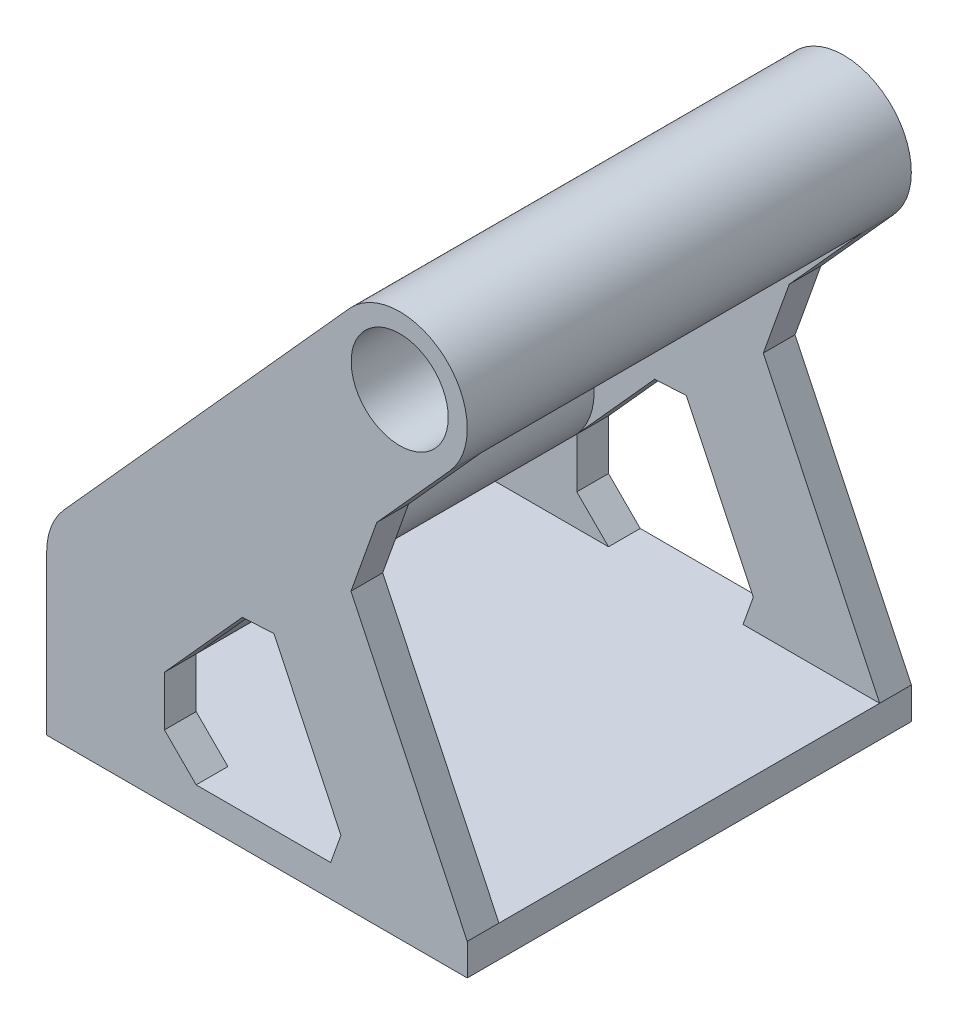
from build123d import *
from OCP.BRepFilletAPI import BRepFilletAPI_MakeChamfer
from build123d.topology import SkipClean

# Parameters (mm, degrees)
SKETCH1_R           = 7.65
BOSS_EXTRUDE2_DEPTH = 5
SKETCH2_R           = 10.65
SKETCH2_R_2         = 7.65
BOSS_EXTRUDE3_DEPTH = 60
SKETCH3_R           = 10.65
SKETCH3_R_2         = 7.65
SKETCH3_W           = 66.3
SKETCH3_H           = 5
BOSS_EXTRUDE4_DEPTH = 60
SKETCH5_R           = 7.65
BOSS_EXTRUDE6_DEPTH = 5
CHAMFER1_SIZE       = 5
CHAMFER1_SIZE2      = 9.294031135
CHAMFER2_SIZE       = 5
CHAMFER2_SIZE2      = 3.822949684
CHAMFER3_SIZE       = 5
CHAMFER3_SIZE2      = 3.753649837


with BuildPart() as part:
    # Sketch1 → Boss-Extrude2 (new body)
    with BuildSketch(Plane.XY):
        with BuildLine():
            Line((-7.916082658, 7.124474392), (37.083917342, 57.124474392))
            ThreePointArc((37.083917342, 57.124474392), (52.124474392, 57.916082658), (52.916082658, 42.875525608))
            Line((52.916082658, 42.875525608), (35.178678596, 23.167298873))
            Line((35.178678596, 23.167298873), (55.65, -20))
            Line((55.65, -20), (55.65, -25))
            Line((55.65, -25), (-10.65, -25))
            Line((-10.65, -25), (-10.65, 0))
            ThreePointArc((-10.65, 0), (-9.943057384, 3.815509121), (-7.916082658, 7.124474392))
        make_face()
        Circle(SKETCH1_R, mode=Mode.SUBTRACT)
        with Locations((45, 50)):
            Circle(SKETCH1_R, mode=Mode.SUBTRACT)
        Polygon((23.537976673, 10.233185625), (7.916082658, -7.124474392), (7.916082658, -20), (37.875525608, -20), align=None, mode=Mode.SUBTRACT)
    extrude(amount=BOSS_EXTRUDE2_DEPTH)

    # Sketch2 → Boss-Extrude3 (add)
    with SkipClean():  # the faces are left unmerged after this step: merging them gives an invalid solid
        with BuildSketch(Plane.XY.offset(5)):
            with Locations((45, 50)):
                Circle(SKETCH2_R)
            with Locations((45, 50)):
                Circle(SKETCH2_R_2, mode=Mode.SUBTRACT)
        extrude(amount=BOSS_EXTRUDE3_DEPTH)
    add(part.part.scale(1), mode=Mode.REPLACE)  # the faces are merged on a copy

    # Sketch3 → Boss-Extrude4 (add)
    # profile 1 of 2: a face of its own
    with SkipClean():  # the faces are left unmerged after this step: merging them gives an invalid solid
        with BuildSketch(Plane.XY.offset(5)):
            Circle(SKETCH3_R)
            Circle(SKETCH3_R_2, mode=Mode.SUBTRACT)
        # profile 2 of 2: a face of its own
        with BuildSketch(Plane.XY.offset(5)):
            with Locations((22.5, -22.5)):
                Rectangle(SKETCH3_W, SKETCH3_H)
        extrude(amount=BOSS_EXTRUDE4_DEPTH)

    # Sketch5 → Boss-Extrude6 (add)
    with BuildSketch(Plane.XY.offset(65)):
        with BuildLine():
            Line((-10.65, 0), (-10.65, -25))
            Line((-10.65, -25), (55.65, -25))
            Line((55.65, -25), (55.65, -20))
            Line((55.65, -20), (35.178678596, 23.167298873))
            Line((35.178678596, 23.167298873), (52.916082658, 42.875525608))
            ThreePointArc((52.916082658, 42.875525608), (52.124474392, 57.916082658), (37.083917342, 57.124474392))
            Line((37.083917342, 57.124474392), (-7.916082658, 7.124474392))
            ThreePointArc((-7.916082658, 7.124474392), (-9.943057384, 3.815509121), (-10.65, 0))
        make_face()
        Polygon((7.916082658, -20), (7.916082658, -7.124474392), (23.537976673, 10.233185625), (37.875525608, -20), align=None, mode=Mode.SUBTRACT)
        with Locations((45, 50)):
            Circle(SKETCH5_R, mode=Mode.SUBTRACT)
    extrude(amount=BOSS_EXTRUDE6_DEPTH)

    # Chamfer1: one chamfer whose edges measure the first distance from different faces: ONE call of the kernel's chamfer builder (chamfer() names one face for all edges)
    chamfer1_edges_1 = [part.edges().sort_by_distance(p)[0] for p in [
        (35.178678596, 23.167298873, 2.5),
    ]]
    chamfer1_side_1 = [part.faces().sort_by_distance(p)[0] for p in [
        (45.414339298, 1.583649437, 2.5),
    ]]
    chamfer1_edges_2 = [part.edges().sort_by_distance(p)[0] for p in [
        (35.178678596, 23.167298873, 67.5),
    ]]
    chamfer1_side_2 = [part.faces().sort_by_distance(p)[0] for p in [
        (45.414339298, 1.583649437, 67.5),
    ]]
    chamfer1 = BRepFilletAPI_MakeChamfer(part.part.solid().wrapped)
    for e in chamfer1_edges_1:
        chamfer1.Add(CHAMFER1_SIZE, CHAMFER1_SIZE2, e.wrapped, chamfer1_side_1[0].wrapped)  # the first distance lies on this face
    for e in chamfer1_edges_2:
        chamfer1.Add(CHAMFER1_SIZE, CHAMFER1_SIZE2, e.wrapped, chamfer1_side_2[0].wrapped)  # the first distance lies on this face
    add(Compound.cast(chamfer1.Shape()), mode=Mode.REPLACE)

    # Chamfer2: one chamfer whose edges measure the first distance from different faces: ONE call of the kernel's chamfer builder (chamfer() names one face for all edges)
    chamfer2_edges_1 = [part.edges().sort_by_distance(p)[0] for p in [
        (23.537976673, 10.233185625, 2.5),
    ]]
    chamfer2_side_1 = [part.faces().sort_by_distance(p)[0] for p in [
        (15.727029665, 1.554355617, 2.5),
    ]]
    chamfer2_edges_2 = [part.edges().sort_by_distance(p)[0] for p in [
        (23.537976673, 10.233185625, 67.5),
    ]]
    chamfer2_side_2 = [part.faces().sort_by_distance(p)[0] for p in [
        (15.727029665, 1.554355617, 67.5),
    ]]
    chamfer2 = BRepFilletAPI_MakeChamfer(part.part.solid().wrapped)
    for e in chamfer2_edges_1:
        chamfer2.Add(CHAMFER2_SIZE, CHAMFER2_SIZE2, e.wrapped, chamfer2_side_1[0].wrapped)  # the first distance lies on this face
    for e in chamfer2_edges_2:
        chamfer2.Add(CHAMFER2_SIZE, CHAMFER2_SIZE2, e.wrapped, chamfer2_side_2[0].wrapped)  # the first distance lies on this face
    add(Compound.cast(chamfer2.Shape()), mode=Mode.REPLACE)

    # Chamfer3: one chamfer whose edges measure the first distance from different faces: ONE call of the kernel's chamfer builder (chamfer() names one face for all edges)
    chamfer3_edges_1 = [part.edges().sort_by_distance(p)[0] for p in [
        (37.875525608, -20, 2.5),
    ]]
    chamfer3_side_1 = [part.faces().sort_by_distance(p)[0] for p in [
        (31.525800275, -6.610513028, 2.5),
    ]]
    chamfer3_edges_2 = [part.edges().sort_by_distance(p)[0] for p in [
        (7.916082658, -20, 2.5),
        (7.916082658, -20, 67.5),
    ]]
    chamfer3_edges_3 = [part.edges().sort_by_distance(p)[0] for p in [
        (37.875525608, -20, 67.5),
    ]]
    chamfer3_side_3 = [part.faces().sort_by_distance(p)[0] for p in [
        (31.525800275, -6.610513028, 67.5),
    ]]
    chamfer3 = BRepFilletAPI_MakeChamfer(part.part.solid().wrapped)
    for e in chamfer3_edges_1:
        chamfer3.Add(CHAMFER3_SIZE, CHAMFER3_SIZE2, e.wrapped, chamfer3_side_1[0].wrapped)  # the first distance lies on this face
    for e in chamfer3_edges_2:
        chamfer3.Add(CHAMFER3_SIZE, e.wrapped)
    for e in chamfer3_edges_3:
        chamfer3.Add(CHAMFER3_SIZE, CHAMFER3_SIZE2, e.wrapped, chamfer3_side_3[0].wrapped)  # the first distance lies on this face
    add(Compound.cast(chamfer3.Shape()), mode=Mode.REPLACE)


solid = part.part
